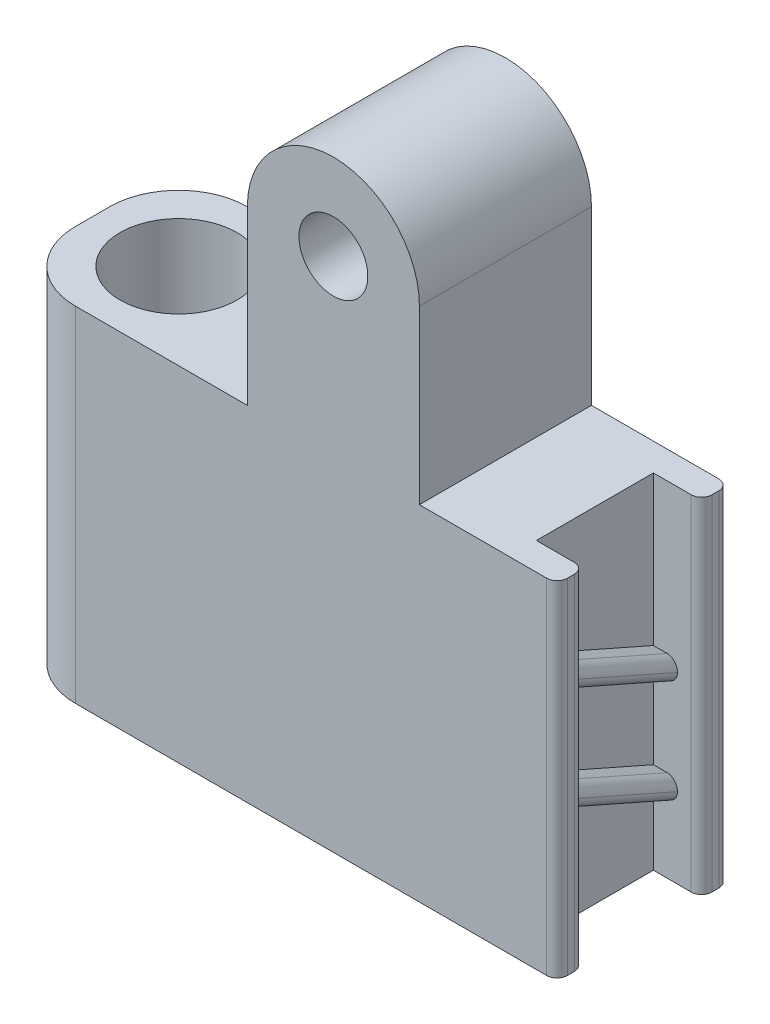
from build123d import *

# Parameters (mm, degrees)
SKETCH_1_R      = 1.7
EXTRUDE_1_DEPTH = 10
EXTRUDE_2_DEPTH = 1.3
FILLET_1_R      = 0.3
FILLET_2_R      = 0.3
SKETCH_3_R      = 1
EXTRUDE_3_DEPTH = 5
FILLET_3_R      = 2
SKETCH_4_W      = 3.4
SKETCH_4_H      = 10
EXTRUDE_4_DEPTH = 0.6


with BuildPart() as part:
    # 草圖1 → 填料-伸長1 (new body)
    with BuildSketch(Plane(origin=(0, 0, 0), x_dir=(1, 0, 0), z_dir=(0, 1, 0))):
        Polygon((13.5, -0.8), (11.5, -0.8), (11.5, -4.2), (13.5, -4.2), (13.5, -5), (0, -5), (-2.5, -5), (-2.5, 0), (0, 0), (13.5, 0), align=None)
        with Locations(Location((0, -2.5, 0), (0, 0, 270))):
            Circle(SKETCH_1_R, mode=Mode.SUBTRACT)
    extrude(amount=EXTRUDE_1_DEPTH)

    # 草圖2 → 填料-伸長2 (add)
    with BuildSketch(Plane(origin=(11.5, 0, 0), x_dir=(0, 0, -1), z_dir=(1, 0, 0))):
        Polygon((-4.2, 7.155796618), (-0.8, 5.655796618), (-0.8, 5), (-4.2, 6.5), align=None)
        Polygon((-4.2, 4.155796618), (-0.8, 2.655796618), (-0.8, 2), (-4.2, 3.5), align=None)
    extrude(amount=EXTRUDE_2_DEPTH)

    # 圓角1
    fillet_1_edges = [part.edges().sort_by_distance(p)[0] for p in [
        (12.8, 6.405796618, 2.5),
        (12.8, 5.75, 2.5),
        (12.8, 3.405796618, 2.5),
        (12.8, 2.75, 2.5),
    ]]
    fillet(fillet_1_edges, radius=FILLET_1_R - 0.0001)  # a hair under: the kernel refuses the full size

    # 圓角2
    fillet_2_edges = [part.edges().sort_by_distance(p)[0] for p in [
        (13.5, 5, 0),
        (13.5, 5, 0.8),
        (13.5, 5, 4.2),
        (13.5, 5, 5),
    ]]
    fillet(fillet_2_edges, radius=FILLET_2_R)

    # 草圖3 → 填料-伸長3 (add)
    with BuildSketch(Plane.XY):
        with BuildLine():
            Line((4.5, 10), (4.5, 15))
            ThreePointArc((4.5, 15), (7, 17.5), (9.5, 15))
            Line((9.5, 15), (9.5, 10))
            Line((9.5, 10), (4.5, 10))
        make_face()
        with Locations(Location((7, 15, 0), (0, 0, 180))):
            Circle(SKETCH_3_R, mode=Mode.SUBTRACT)
    extrude(amount=EXTRUDE_3_DEPTH)

    # 圓角3
    fillet_3_edges = [part.edges().sort_by_distance(p)[0] for p in [
        (-2.5, 5, 5),
        (-2.5, 5, 0),
    ]]
    fillet(fillet_3_edges, radius=FILLET_3_R)

    # 草圖4 → 填料-伸長4 (add)
    with BuildSketch(Plane(origin=(11.5, 0, 0), x_dir=(0, 0, -1), z_dir=(1, 0, 0))):
        with Locations((-2.5, 5)):
            Rectangle(SKETCH_4_W, SKETCH_4_H)
    extrude(amount=EXTRUDE_4_DEPTH)


solid = part.part
